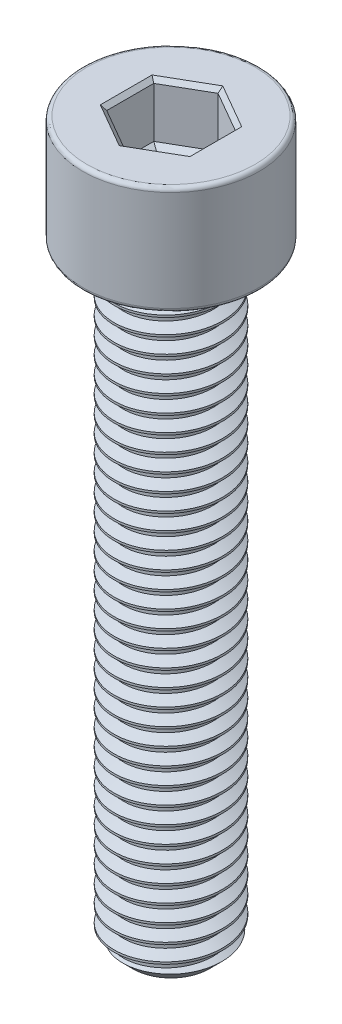
from build123d import *

# Parameters (mm, degrees)
SKETCH1_R           = 4
BOSS_EXTRUDE1_DEPTH = 45
THREAD1_PITCH       = 1.25
SKETCH2_R           = 6.5
BOSS_EXTRUDE2_DEPTH = 8
FILLET1_R           = 0.3
CUT_EXTRUDE1_DEPTH  = 4
CHAMFER1_SIZE       = 0.3
CUT_EXTRUDE2_DEPTH  = 0.4
CUT_EXTRUDE2_DRAFT  = -60


with BuildPart() as part:
    # Sketch1 → Boss-Extrude1 (new body)
    with BuildSketch(Plane(origin=(0, 0, 0), x_dir=(1, 0, 0), z_dir=(0, 1, 0))):
        with Locations(Location((0, 0, 0), (0, 0, 90))):
            Circle(SKETCH1_R)
    extrude(amount=BOSS_EXTRUDE1_DEPTH)

    # Thread1: arcs per turn and ends read off the stored shape
    # Thread1: the profile of Thread Profile1 profile screwed along a right-hand helix through 37.8 turns, 8 arcs to a turn; built about Z, then put on its axis
    thread1_z = Axis((0, 0, 0), (0, 0, 1))
    thread1_corners = [(4.0003, 0, -0.000173205), (4.0003, 0, 1.093923202), (3.323417656, 0, 0.703124998), (3.323417656, 0, 0.390624998)]
    with BuildLine(mode=Mode.PRIVATE) as thread1_profile:
        Line(thread1_corners[0], thread1_corners[1])
        Line(thread1_corners[1], thread1_corners[2])
        Line(thread1_corners[2], thread1_corners[3])
        Line(thread1_corners[3], thread1_corners[0])
    thread1_cap = Face(thread1_profile.wire())
    thread1_turn_angles = [0, 22.5, 45, 67.5, 90, 112.5, 135, 157.5, 180, 202.5, 225, 247.5, 270, 292.5, 315, 337.5, 360]
    thread1_turn_weights = [1, 0.9238795325112867, 1, 0.9238795325112867, 1, 0.9238795325112867, 1, 0.9238795325112867, 1, 0.9238795325112867, 1, 0.9238795325112867, 1, 0.9238795325112867, 1, 0.9238795325112867, 1]
    thread1_turn_rails = [Edge.make_bspline([Vector(p[0], p[1], 0).rotate(thread1_z, thread1_turn_angles[k]) / thread1_turn_weights[k] + Vector(0, 0, p[2] + THREAD1_PITCH * thread1_turn_angles[k] / 360) for k in range(17)], [0, 0, 0, 1, 1, 2, 2, 3, 3, 4, 4, 5, 5, 6, 6, 7, 7, 8, 8, 8], 2, thread1_turn_weights) for p in thread1_corners]
    thread1_turn_sides = [Face.make_surface_from_curves(thread1_turn_rails[p[0]], thread1_turn_rails[p[1]]) for p in [(0, 1), (1, 2), (2, 3), (3, 0)]]
    thread1_last_angles = [13320, 13342.5, 13365, 13387.5, 13410, 13432.5, 13455, 13477.5, 13500, 13522.5, 13545, 13567.5, 13590, 13599, 13608]
    thread1_last_weights = [1, 0.9238795325112867, 1, 0.9238795325112867, 1, 0.9238795325112867, 1, 0.9238795325112867, 1, 0.9238795325112867, 1, 0.9238795325112867, 1, 0.9876883405951378, 1]
    thread1_last_rails = [Edge.make_bspline([Vector(p[0], p[1], 0).rotate(thread1_z, thread1_last_angles[k]) / thread1_last_weights[k] + Vector(0, 0, p[2] + THREAD1_PITCH * thread1_last_angles[k] / 360) for k in range(15)], [0, 0, 0, 1, 1, 2, 2, 3, 3, 4, 4, 5, 5, 6, 6, 7, 7, 7], 2, thread1_last_weights) for p in thread1_corners]
    thread1_last_sides = [Face.make_surface_from_curves(thread1_last_rails[p[0]], thread1_last_rails[p[1]]) for p in [(0, 1), (1, 2), (2, 3), (3, 0)]]
    thread1 = Plane(origin=(0, 46.25, 0), x_dir=(-1, 0, 0), z_dir=(0, -1, 0)) * Solid(Shell([*[p.moved(Location((0, 0, THREAD1_PITCH * i))) for i in range(37) for p in thread1_turn_sides], *thread1_last_sides, thread1_cap, thread1_cap.rotate(thread1_z, 13608).moved(Location((0, 0, THREAD1_PITCH * 13608 / 360)))]))
    add(thread1, mode=Mode.SUBTRACT)

    # Sketch2 → Boss-Extrude2 (add)
    with BuildSketch(Plane(origin=(0, 45, 0), x_dir=(1, 0, 0), z_dir=(0, 1, 0))):
        with Locations(Location((0, 0, 0), (0, 0, 270))):
            Circle(SKETCH2_R)
    extrude(amount=BOSS_EXTRUDE2_DEPTH)

    # Sketch5 → Cut-Revolve1 (revolve, cut)
    with BuildSketch(Plane.XY, mode=Mode.PRIVATE) as cut_revolve1_sk:
        Polygon((4.01, 0), (4.01, 1.2), (2.81, 0), align=None)
    revolve(cut_revolve1_sk.sketch.rotate(Axis((0, 0, 0), (0, 1, 0)), 170.138426735), axis=Axis((0, 0, 0), (0, 1, 0)), mode=Mode.SUBTRACT)

    # Fillet1
    fillet1_edges = [part.edges().sort_by_distance(p)[0] for p in [
        (0, 45, -6.5),
        (0, 53, -6.5),
    ]]
    fillet(fillet1_edges, radius=FILLET1_R)

    # Sketch6 → Cut-Extrude1 (cut)
    with BuildSketch(Plane(origin=(0, 53, 0), x_dir=(1, 0, 0), z_dir=(0, 1, 0))):
        Polygon((0, 3.464101615), (-3, 1.732050808), (-3, -1.732050808), (0, -3.464101615), (3, -1.732050808), (3, 1.732050808), align=None)
    extrude(amount=-CUT_EXTRUDE1_DEPTH, mode=Mode.SUBTRACT)

    # Chamfer1
    chamfer1_edges = [part.edges().sort_by_distance(p)[0] for p in [
        (1.5, 53, -2.598076211),
        (-1.5, 53, -2.598076211),
        (-3, 53, 0),
        (-1.5, 53, 2.598076211),
        (1.5, 53, 2.598076211),
        (3, 53, 0),
    ]]
    chamfer(chamfer1_edges, length=CHAMFER1_SIZE)


with BuildPart() as cut_extrude2_tool:
    # Sketch7 → Cut-Extrude2 (with draft: the straight prism first)
    with BuildSketch(Plane(origin=(0, 49, 0), x_dir=(1, 0, 0), z_dir=(0, 1, 0))):
        Polygon((0, 3.464101615), (-3, 1.732050808), (-3, -1.732050808), (0, -3.464101615), (3, -1.732050808), (3, 1.732050808), align=None)
    extrude(amount=-CUT_EXTRUDE2_DEPTH)
    # Cut-Extrude2: the draft: its side faces are tilted about the plane it starts from
    cut_extrude2_sides = [cut_extrude2_tool.faces().sort_by_distance(p)[0] for p in [
        (-1.5, 48.8, -2.598076211),
        (-3, 48.8, 0),
        (-1.5, 48.8, 2.598076211),
        (1.5, 48.8, 2.598076211),
        (3, 48.8, 0),
        (1.5, 48.8, -2.598076211),
    ]]
    draft(cut_extrude2_sides, Plane(origin=(0, 49, 0), x_dir=(1, 0, 0), z_dir=(0, 1, 0)), CUT_EXTRUDE2_DRAFT)


with BuildPart() as part_1:
    add(part.part)

    # Cut-Extrude2: cut by cut_extrude2_tool
    add(cut_extrude2_tool.part, mode=Mode.SUBTRACT)


solid = part_1.part
